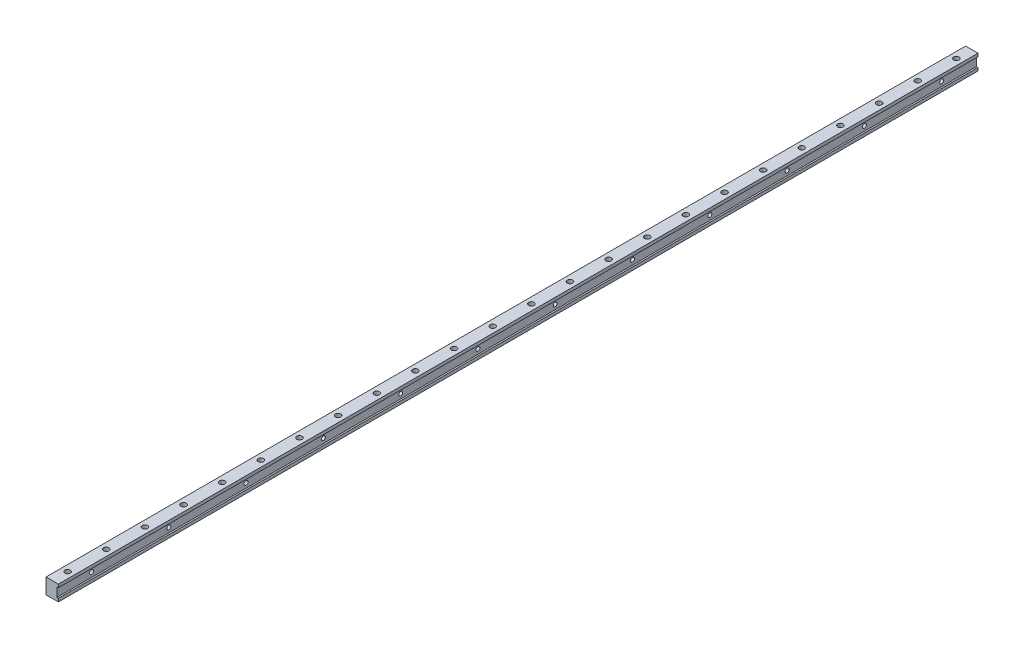
from build123d import *

# Parameters (mm, degrees)
SKETCH1_W           = 8
SKETCH1_H           = 10
BOSS_EXTRUDE1_DEPTH = 595
SKETCH2_R           = 1.75
CUT_EXTRUDE1_DEPTH  = 596.097471008
LPATTERN1_COUNT     = 24
LPATTERN1_PITCH     = 25
SKETCH3_R           = 1.3
CUT_EXTRUDE2_DEPTH  = 596.074785216
LPATTERN2_COUNT     = 12
LPATTERN2_PITCH     = 50
SKETCH4_W           = 1
SKETCH4_H           = 6
CUT_EXTRUDE3_DEPTH  = 596.034452784


with BuildPart() as part:
    # Sketch1 → Boss-Extrude1 (new body)
    with BuildSketch(Plane.XY):
        Rectangle(SKETCH1_W, SKETCH1_H)
    extrude(amount=BOSS_EXTRUDE1_DEPTH)

    # Sketch2 → Cut-Extrude1 (cut, through all)
    with BuildSketch(Plane(origin=(0, 5, 0), x_dir=(1, 0, 0), z_dir=(0, 1, 0))):
        with Locations((0, -10)):
            Circle(SKETCH2_R)
    cut_extrude1 = extrude(amount=-CUT_EXTRUDE1_DEPTH, mode=Mode.SUBTRACT)

    # LPattern1: Cut-Extrude1 ×24
    with Locations(*[(0, 0, i * LPATTERN1_PITCH) for i in range(1, LPATTERN1_COUNT)]):
        add(cut_extrude1, mode=Mode.SUBTRACT)

    # Sketch3 → Cut-Extrude2 (cut, through all)
    with BuildSketch(Plane.ZY.offset(4)):
        with Locations((22.5, 0)):
            Circle(SKETCH3_R)
    cut_extrude2 = extrude(amount=-CUT_EXTRUDE2_DEPTH, mode=Mode.SUBTRACT)

    # LPattern2: Cut-Extrude2 ×12
    with Locations(*[(0, 0, i * LPATTERN2_PITCH) for i in range(1, LPATTERN2_COUNT)]):
        add(cut_extrude2, mode=Mode.SUBTRACT)

    # Sketch4 → Cut-Extrude3 (cut, through all)
    with BuildSketch(Plane(origin=(0, 0, 0), x_dir=(-1, 0, 0), z_dir=(0, 0, -1))):
        with Locations((-3.5, 0)):
            Rectangle(SKETCH4_W, SKETCH4_H)
    extrude(amount=-CUT_EXTRUDE3_DEPTH, mode=Mode.SUBTRACT)


solid = part.part
